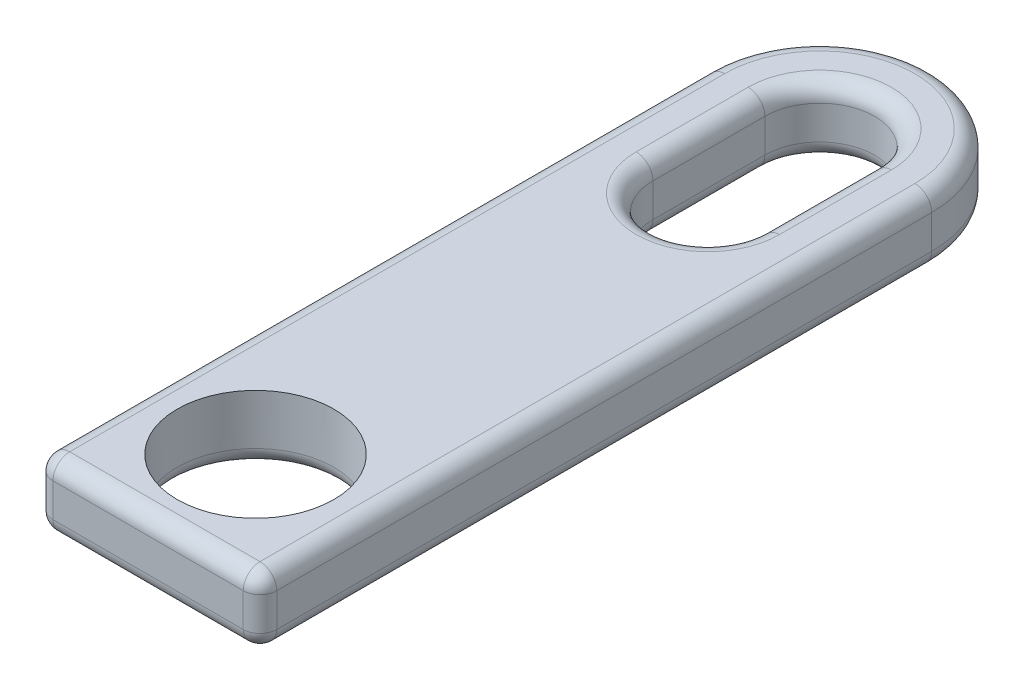
from build123d import *

# Parameters (mm, degrees)
SKETCH1_R           = 3.5
BOSS_EXTRUDE1_DEPTH = 3
FILLET1_R           = 0.75


with BuildPart() as part:
    # Sketch1 → Boss-Extrude1 (new body)
    with BuildSketch(Plane(origin=(0, 0, 0), x_dir=(1, 0, 0), z_dir=(0, 1, 0))):
        with BuildLine():
            Line((-5, -37.44915748), (5, -37.44915748))
            Line((5, -37.44915748), (5, -7.44915748))
            ThreePointArc((5, -7.44915748), (0, -2.44915748), (-5, -7.44915748))
            Line((-5, -7.44915748), (-5, -37.44915748))
        make_face()
        with Locations(Location((0, -32.64915748, 0), (0, 0, 270))):
            Circle(SKETCH1_R, mode=Mode.SUBTRACT)
        with BuildLine():
            Line((2.45, -7.44915748), (2.45, -12.44915748))
            ThreePointArc((2.45, -12.44915748), (0, -14.89915748), (-2.45, -12.44915748))
            Line((-2.45, -12.44915748), (-2.45, -7.44915748))
            ThreePointArc((-2.45, -7.44915748), (0, -4.99915748), (2.45, -7.44915748))
        make_face(mode=Mode.SUBTRACT)
    extrude(amount=BOSS_EXTRUDE1_DEPTH)

    # Fillet1
    # the kernel refuses this fillet: 0.75 mm, written as the material it takes off along each edge
    with BuildSketch(Plane(origin=(-4.25, 2.25, 36.69915748), x_dir=(0, 0, 1), z_dir=(-1, 0, 0))) as fillet1_piece_1_section:
        Polygon((0, 0), (FILLET1_R, 0), (FILLET1_R, FILLET1_R), (0, FILLET1_R), align=None)
    fillet1_piece_1 = extrude(amount=FILLET1_R, mode=Mode.PRIVATE)
    fillet1_piece_1 = fillet1_piece_1 - Plane(origin=(-4.25, 2.25, 36.69915748), x_dir=(0, -0.7071067811865475, -0.7071067811865475), z_dir=(-1, 0, 0)) * Sphere(FILLET1_R, mode=Mode.PRIVATE)
    add(fillet1_piece_1, mode=Mode.SUBTRACT)
    with BuildSketch(Plane(origin=(4.25, 2.25, 36.69915748), x_dir=(0, 1, 0), z_dir=(0, 0, 1))) as fillet1_piece_2_section:
        Polygon((0, 0), (FILLET1_R, 0), (FILLET1_R, -FILLET1_R), (0, -FILLET1_R), align=None)
    fillet1_piece_2 = extrude(amount=FILLET1_R, mode=Mode.PRIVATE)
    fillet1_piece_2 = fillet1_piece_2 - Plane(origin=(4.25, 2.25, 36.69915748), x_dir=(-0.7071067811865475, -0.7071067811865475, 0), z_dir=(0, 0, 1)) * Sphere(FILLET1_R, mode=Mode.PRIVATE)
    add(fillet1_piece_2, mode=Mode.SUBTRACT)
    with BuildSketch(Plane(origin=(-4.25, 0.75, 36.69915748), x_dir=(0, 0, 1), z_dir=(-1, 0, 0))) as fillet1_piece_3_section:
        Polygon((0, 0), (FILLET1_R, 0), (FILLET1_R, -FILLET1_R), (0, -FILLET1_R), align=None)
    fillet1_piece_3 = extrude(amount=FILLET1_R, mode=Mode.PRIVATE)
    fillet1_piece_3 = fillet1_piece_3 - Plane(origin=(-4.25, 0.75, 36.69915748), x_dir=(0, 0.7071067811865475, -0.7071067811865475), z_dir=(-1, 0, 0)) * Sphere(FILLET1_R, mode=Mode.PRIVATE)
    add(fillet1_piece_3, mode=Mode.SUBTRACT)
    with BuildSketch(Plane(origin=(4.25, 0.75, 36.69915748), x_dir=(1, 0, 0), z_dir=(0, 0, 1))) as fillet1_piece_4_section:
        Polygon((0, 0), (FILLET1_R, 0), (FILLET1_R, -FILLET1_R), (0, -FILLET1_R), align=None)
    fillet1_piece_4 = extrude(amount=FILLET1_R, mode=Mode.PRIVATE)
    fillet1_piece_4 = fillet1_piece_4 - Plane(origin=(4.25, 0.75, 36.69915748), x_dir=(-0.7071067811865475, 0.7071067811865475, 0), z_dir=(0, 0, 1)) * Sphere(FILLET1_R, mode=Mode.PRIVATE)
    add(fillet1_piece_4, mode=Mode.SUBTRACT)
    with BuildSketch(Plane(origin=(-5, 3, 7.44915748), x_dir=(0, -1, 0), z_dir=(0, 0, 1)), Plane(origin=(5, 3, 36.69915748), x_dir=(0, -1, 0), z_dir=(0, 0, -1))) as fillet1_piece_5:
        with BuildLine():
            CenterArc((FILLET1_R, FILLET1_R), FILLET1_R, 180, 90)
            Line((0, FILLET1_R), (0, 0))
            Line((0, 0), (FILLET1_R, 0))
        make_face()
    extrude(amount=29.25, mode=Mode.SUBTRACT)
    with BuildSketch(Plane(origin=(0, 0, 7.44915748), x_dir=(-1, 0, 0), z_dir=(0, 0, 1))) as fillet1_piece_6:
        with BuildLine():
            CenterArc((2.45 + FILLET1_R, -FILLET1_R), FILLET1_R, 90, 90)
            Line((2.45 + FILLET1_R, 0), (2.45, 0))
            Line((2.45, 0), (2.45, -FILLET1_R))
        make_face()
    revolve(axis=Axis((0, 0, 7.44915748), (0, -1, 0)), revolution_arc=180, mode=Mode.SUBTRACT)
    with BuildSketch(Plane(origin=(-2.45, 0, 12.44915748), x_dir=(0, 1, 0), z_dir=(0, 0, -1)), Plane(origin=(2.45, 0, 7.44915748), x_dir=(0, 1, 0), z_dir=(0, 0, 1))) as fillet1_piece_7:
        with BuildLine():
            CenterArc((FILLET1_R, -FILLET1_R), FILLET1_R, 90, 90)
            Line((0, -FILLET1_R), (0, 0))
            Line((0, 0), (FILLET1_R, 0))
        make_face()
    extrude(amount=5, mode=Mode.SUBTRACT)
    with BuildSketch(Plane(origin=(0, 0, 12.44915748), x_dir=(1, 0, 0), z_dir=(0, 0, -1))) as fillet1_piece_8:
        with BuildLine():
            CenterArc((2.45 + FILLET1_R, -FILLET1_R), FILLET1_R, 90, 90)
            Line((2.45 + FILLET1_R, 0), (2.45, 0))
            Line((2.45, 0), (2.45, -FILLET1_R))
        make_face()
    revolve(axis=Axis((0, 0, 12.44915748), (0, -1, 0)), revolution_arc=180, mode=Mode.SUBTRACT)
    with BuildSketch(Plane(origin=(0, 3, 7.44915748), x_dir=(-1, 0, 0), z_dir=(0, 0, 1))) as fillet1_piece_9:
        with BuildLine():
            CenterArc((2.45 + FILLET1_R, FILLET1_R), FILLET1_R, 180, 90)
            Line((2.45 + FILLET1_R, 0), (2.45, 0))
            Line((2.45, 0), (2.45, FILLET1_R))
        make_face()
    revolve(axis=Axis((0, 3, 7.44915748), (0, -1, 0)), revolution_arc=180, mode=Mode.SUBTRACT)
    with BuildSketch(Plane(origin=(-4.25, 3, 37.44915748), x_dir=(0, -1, 0), z_dir=(1, 0, 0))) as fillet1_piece_10:
        with BuildLine():
            CenterArc((FILLET1_R, FILLET1_R), FILLET1_R, 180, 90)
            Line((0, FILLET1_R), (0, 0))
            Line((0, 0), (FILLET1_R, 0))
        make_face()
    extrude(amount=8.5, mode=Mode.SUBTRACT)
    with BuildSketch(Plane(origin=(-2.45, 3, 12.44915748), x_dir=(0, -1, 0), z_dir=(0, 0, -1)), Plane(origin=(2.45, 3, 7.44915748), x_dir=(0, -1, 0), z_dir=(0, 0, 1))) as fillet1_piece_11:
        with BuildLine():
            CenterArc((FILLET1_R, FILLET1_R), FILLET1_R, 180, 90)
            Line((0, FILLET1_R), (0, 0))
            Line((0, 0), (FILLET1_R, 0))
        make_face()
    extrude(amount=5, mode=Mode.SUBTRACT)
    with BuildSketch(Plane(origin=(0, 3, 12.44915748), x_dir=(1, 0, 0), z_dir=(0, 0, -1))) as fillet1_piece_12:
        with BuildLine():
            CenterArc((2.45 + FILLET1_R, FILLET1_R), FILLET1_R, 180, 90)
            Line((2.45 + FILLET1_R, 0), (2.45, 0))
            Line((2.45, 0), (2.45, FILLET1_R))
        make_face()
    revolve(axis=Axis((0, 3, 12.44915748), (0, -1, 0)), revolution_arc=180, mode=Mode.SUBTRACT)
    with BuildSketch(Plane(origin=(0, 0, 32.64915748), x_dir=(0, 0, 1), z_dir=(-1, 0, 0))) as fillet1_piece_13:
        with BuildLine():
            CenterArc((3.5 + FILLET1_R, FILLET1_R), FILLET1_R, 180, 90)
            Line((3.5 + FILLET1_R, 0), (3.5, 0))
            Line((3.5, 0), (3.5, FILLET1_R))
        make_face()
    revolve(axis=Axis((0, 0, 32.64915748), (0, 1, 0)), mode=Mode.SUBTRACT)
    with BuildSketch(Plane(origin=(-4.25, 0, 37.44915748), x_dir=(0, 1, 0), z_dir=(1, 0, 0))) as fillet1_piece_14:
        with BuildLine():
            CenterArc((FILLET1_R, -FILLET1_R), FILLET1_R, 90, 90)
            Line((0, -FILLET1_R), (0, 0))
            Line((0, 0), (FILLET1_R, 0))
        make_face()
    extrude(amount=8.5, mode=Mode.SUBTRACT)
    with BuildSketch(Plane(origin=(-5, 0, 7.44915748), x_dir=(0, 1, 0), z_dir=(0, 0, 1)), Plane(origin=(5, 0, 36.69915748), x_dir=(0, 1, 0), z_dir=(0, 0, -1))) as fillet1_piece_15:
        with BuildLine():
            CenterArc((FILLET1_R, -FILLET1_R), FILLET1_R, 90, 90)
            Line((0, -FILLET1_R), (0, 0))
            Line((0, 0), (FILLET1_R, 0))
        make_face()
    extrude(amount=29.25, mode=Mode.SUBTRACT)
    with BuildSketch(Plane(origin=(0, 0, 7.44915748), x_dir=(1, 0, 0), z_dir=(0, 0, 1))) as fillet1_piece_16:
        with BuildLine():
            CenterArc((5 - FILLET1_R, FILLET1_R), FILLET1_R, 270, 90)
            Line((5 - FILLET1_R, 0), (5, 0))
            Line((5, 0), (5, FILLET1_R))
        make_face()
    revolve(axis=Axis((0, 0, 7.44915748), (0, 1, 0)), revolution_arc=180, mode=Mode.SUBTRACT)
    with BuildSketch(Plane(origin=(5, 0.75, 37.44915748), x_dir=(-1, 0, 0), z_dir=(0, 1, 0)), Plane(origin=(-5, 0.75, 37.44915748), x_dir=(0, 0, -1), z_dir=(0, 1, 0))) as fillet1_piece_17:
        with BuildLine():
            CenterArc((FILLET1_R, -FILLET1_R), FILLET1_R, 90, 90)
            Line((0, -FILLET1_R), (0, 0))
            Line((0, 0), (FILLET1_R, 0))
        make_face()
    extrude(amount=1.5, mode=Mode.SUBTRACT)
    with BuildSketch(Plane(origin=(0, 3, 7.44915748), x_dir=(1, 0, 0), z_dir=(0, 0, 1))) as fillet1_piece_18:
        with BuildLine():
            CenterArc((5 - FILLET1_R, -FILLET1_R), FILLET1_R, 0, 90)
            Line((5 - FILLET1_R, 0), (5, 0))
            Line((5, 0), (5, -FILLET1_R))
        make_face()
    revolve(axis=Axis((0, 3, 7.44915748), (0, 1, 0)), revolution_arc=180, mode=Mode.SUBTRACT)


solid = part.part
